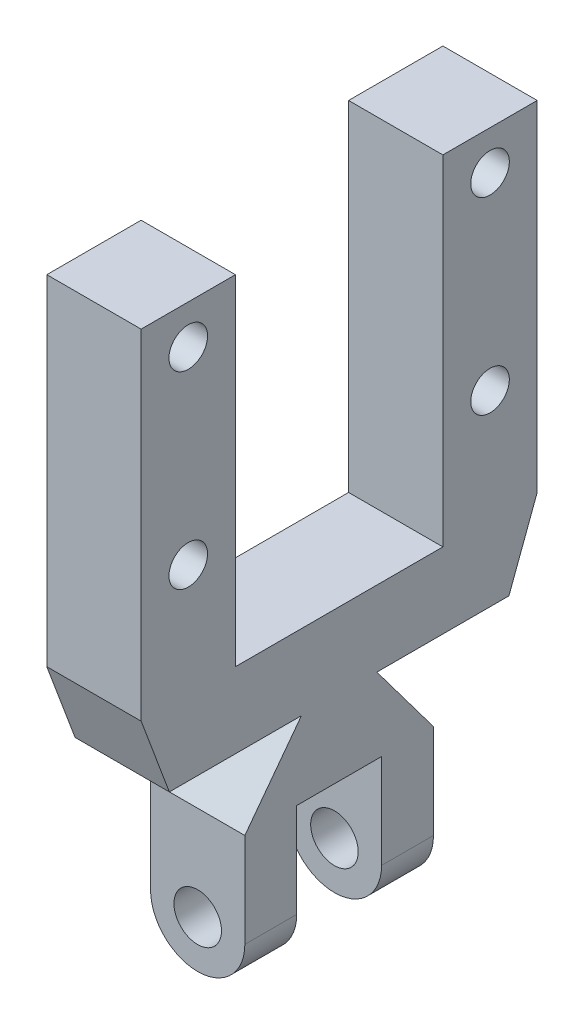
from build123d import *

# Parameters (mm, degrees)
BOSS_EXTRUDE2_DEPTH  = 6.35
CUT_EXTRUDE1_START   = -12.7
CUT_EXTRUDE1_DEPTH   = 12.7
SKETCH17_W           = 6.35
SKETCH17_H           = 9.525
CUT_EXTRUDE2_DEPTH   = 2.8575
M2_CLEARANCE_HOLE1_D = 2.6
M3_CLEARANCE_HOLE1_D = 3.2


with BuildPart() as part:
    # Sketch5 → Boss-Extrude2 (new body)
    with BuildSketch(Plane(origin=(0, 0, 0), x_dir=(0, 0, -1), z_dir=(1, 0, 0))):
        Polygon((-11.43, 5.08), (-2.54, 5.08), (-6.35, 0), (-6.35, -9.525), (6.35, -9.525), (6.35, 0), (2.54, 5.08), (11.43, 5.08), (13.335, 10.16), (13.335, 33.02), (6.985, 33.02), (6.985, 10.16), (-6.985, 10.16), (-6.985, 33.02), (-13.335, 33.02), (-13.335, 10.16), align=None)
    extrude(amount=BOSS_EXTRUDE2_DEPTH)

    # Cut-Extrude1: read off the stored shape, not the designer's step
    # Cut-Extrude1 outline → Cut-Extrude1 (cut)
    with BuildSketch(Plane.XY.offset(6.35).offset(CUT_EXTRUDE1_START)):
        with BuildLine():
            Line((6.35, -9.525), (6.35, -6.35))
            ThreePointArc((6.35, -6.35), (5.42006403, -8.59506403), (3.175, -9.525))
            Line((3.175, -9.525), (6.35, -9.525))
        make_face()
        with BuildLine():
            Line((0, -9.525), (3.175, -9.525))
            ThreePointArc((3.175, -9.525), (0.92993597, -8.59506403), (0, -6.35))
            Line((0, -6.35), (0, -9.525))
        make_face()
    extrude(amount=CUT_EXTRUDE1_DEPTH, mode=Mode.SUBTRACT)

    # Sketch17 → Cut-Extrude2 (cut, symmetric)
    with BuildSketch(Plane.XY):
        with Locations((3.175, -4.7625)):
            Rectangle(SKETCH17_W, SKETCH17_H)
    extrude(amount=CUT_EXTRUDE2_DEPTH, both=True, mode=Mode.SUBTRACT)

    # M2 Clearance Hole1 (through all)
    with Locations(Plane(origin=(6.35, 0, 0), x_dir=(0, 0, -1), z_dir=(1, 0, 0))):
        with Locations((-10.159977629, 17.689823395), (-10.159977629, 30.389823395), (10.160022371, 30.389823395), (10.160022371, 17.689823395)):
            Hole(M2_CLEARANCE_HOLE1_D / 2)

    # M3 Clearance Hole1 (through all)
    with Locations(Plane.XY.offset(6.35)):
        with Locations((3.175, -6.35)):
            Hole(M3_CLEARANCE_HOLE1_D / 2)


solid = part.part
